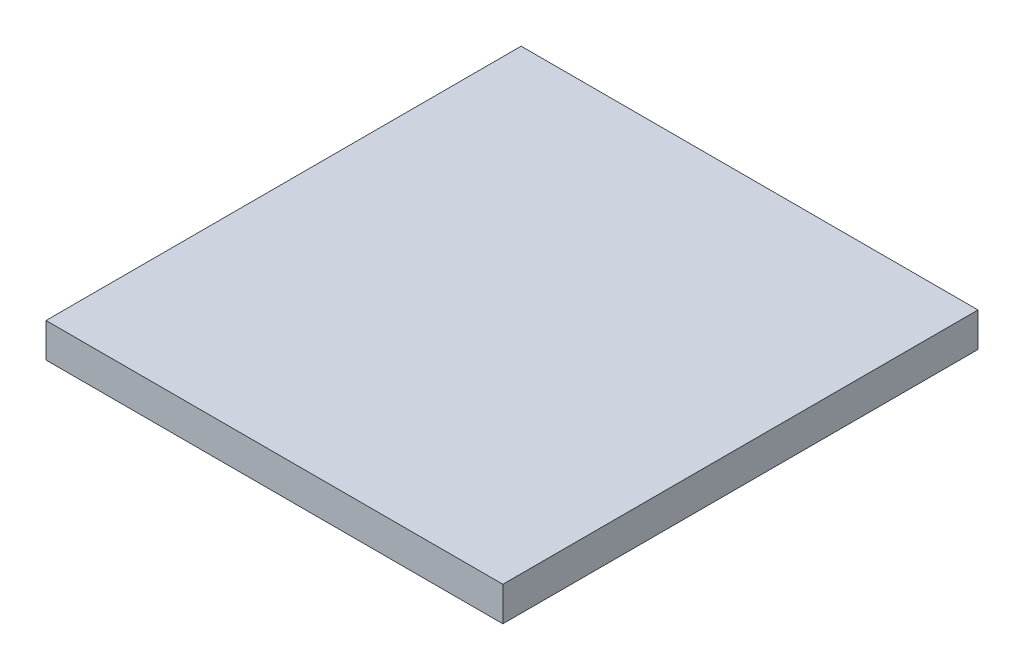
from build123d import *

# Parameters (mm, degrees)
SKETCH2_W           = 50.8
SKETCH2_H           = 3.81
BOSS_EXTRUDE2_DEPTH = 52.832


with BuildPart() as part:
    # Sketch2 → Boss-Extrude2 (new body)
    with BuildSketch(Plane.XY.offset(-86.437932267)):
        with Locations((82.189555788, -701.951445527)):
            Rectangle(SKETCH2_W, SKETCH2_H)
    extrude(amount=BOSS_EXTRUDE2_DEPTH)


solid = part.part
